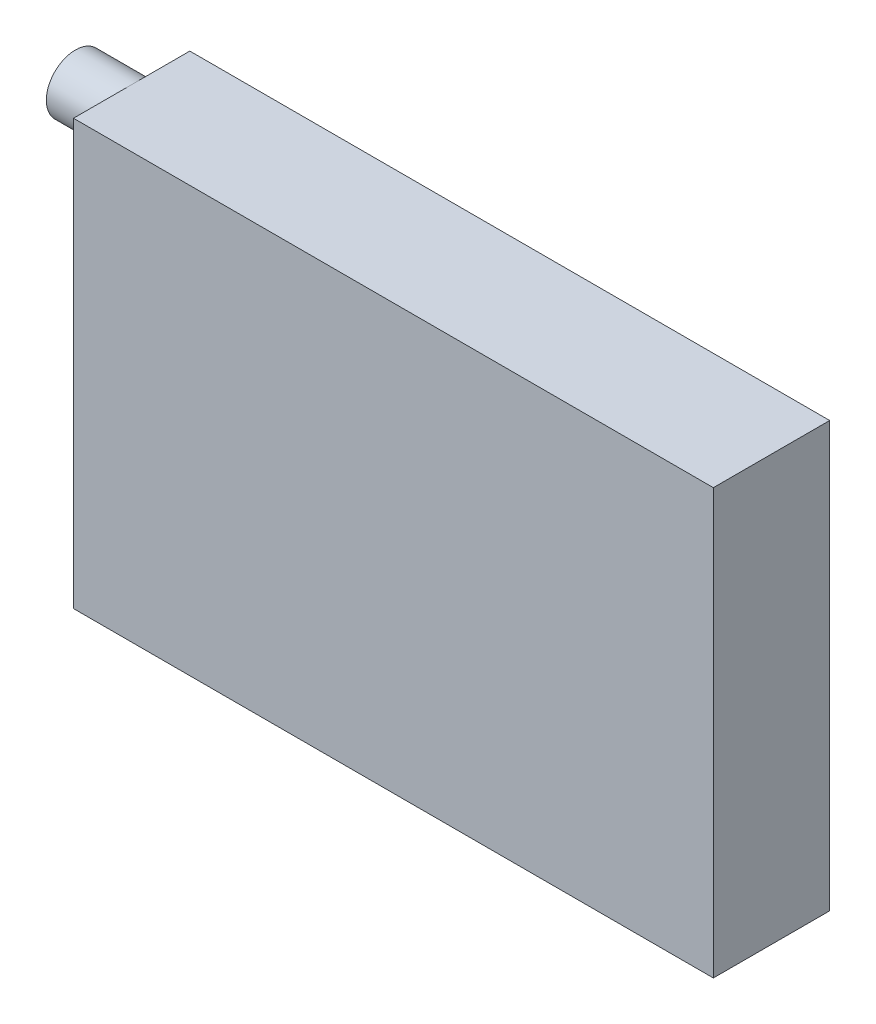
from build123d import *

# Parameters (mm, degrees)
SKETCH_1_W      = 110
SKETCH_1_H      = 73
EXTRUDE_1_DEPTH = 20
SKETCH_2_R      = 5
EXTRUDE_2_DEPTH = 10


with BuildPart() as part:
    # 草图1 → 凸台-拉伸1 (new body)
    with BuildSketch(Plane.XY):
        Rectangle(SKETCH_1_W, SKETCH_1_H)
    extrude(amount=EXTRUDE_1_DEPTH)

    # 草图2 → 凸台-拉伸2 (add)
    with BuildSketch(Plane.ZY.offset(55)):
        with Locations((9.669244668, 31.5)):
            Circle(SKETCH_2_R)
    extrude(amount=EXTRUDE_2_DEPTH)


solid = part.part
